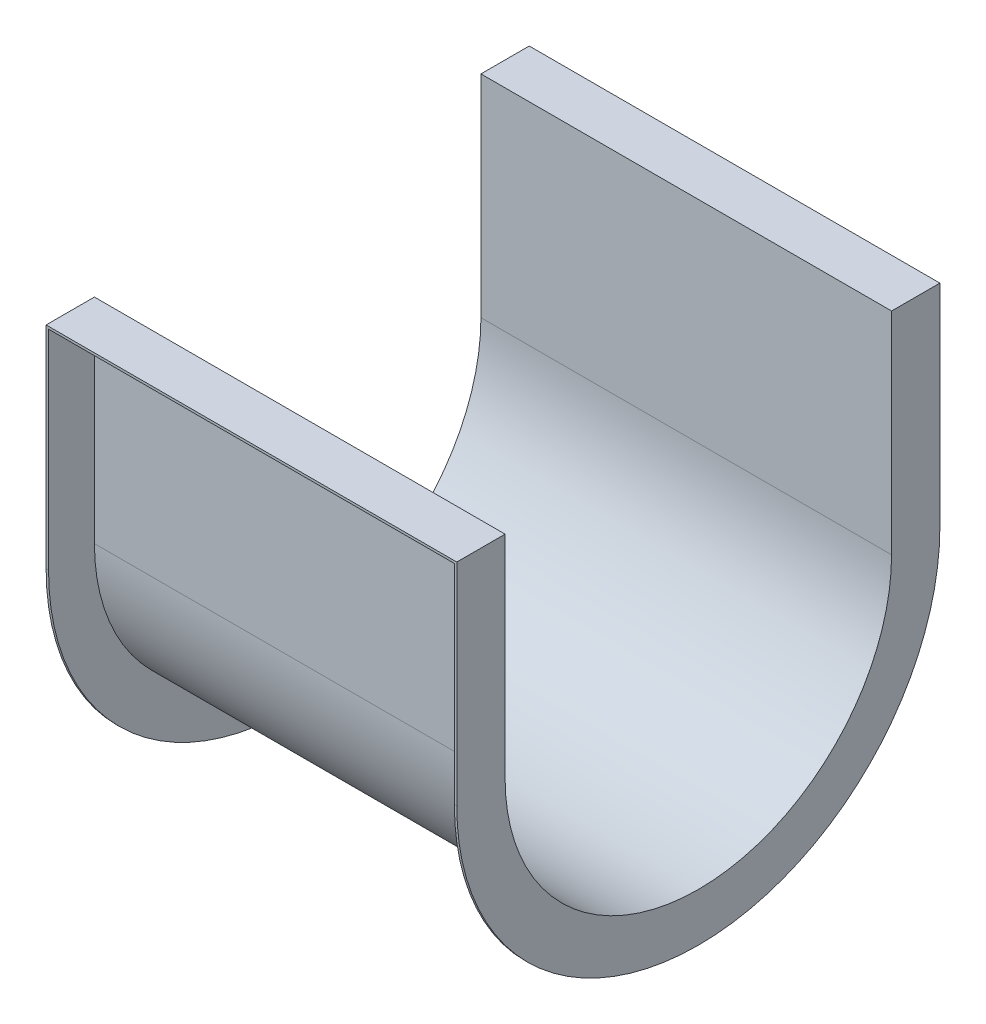
from build123d import *

# Parameters (mm, degrees)
SALIENTE_EXTRUIR1_DEPTH = 170
CROQUIS2_W              = 170
CROQUIS2_H              = 20.000000000000014
SALIENTE_EXTRUIR2_DEPTH = 3.7
VACIADO1_T              = -1


with BuildPart() as part:
    # Croquis1 → Saliente-Extruir1 (new body)
    with BuildSketch(Plane(origin=(0, 0, 0), x_dir=(0, 0, -1), z_dir=(1, 0, 0))):
        with BuildLine():
            Line((80, 0), (100, 0))
            Line((100, 0), (99.99999999999999, -83.7))
            ThreePointArc((99.99999999999999, -83.7), (70.71067811865474, -154.41067811865474), (1.125e-14, -183.7))
            ThreePointArc((1.125e-14, -183.7), (-70.71067811865473, -154.41067811865474), (-99.99999999999999, -83.70000000000002))
            Line((-99.99999999999999, -83.70000000000002), (-100, -1.225e-14))
            Line((-100, -1.225e-14), (-80, -9.8e-15))
            Line((-80, -9.8e-15), (-79.99999999999999, -83.70000000000002))
            ThreePointArc((-79.99999999999999, -83.70000000000002), (-56.568542494923804, -140.26854249492382), (-1.47e-14, -163.70000000000002))
            ThreePointArc((-1.47e-14, -163.70000000000002), (56.5685424949238, -140.26854249492382), (80, -83.70000000000002))
            Line((80, -83.70000000000002), (80, 0))
        make_face()
    extrude(amount=SALIENTE_EXTRUIR1_DEPTH)

    # Croquis2 → Saliente-Extruir2 (add)
    with BuildSketch(Plane(origin=(0, 0, 0), x_dir=(1, 0, 0), z_dir=(0, 1, 0))):
        with Locations((85, 90)):
            Rectangle(CROQUIS2_W, CROQUIS2_H)
        with Locations((85, -90)):
            Rectangle(CROQUIS2_W, CROQUIS2_H)
    extrude(amount=SALIENTE_EXTRUIR2_DEPTH)

    # Vaciado1
    vaciado1_openings = [part.faces().sort_by_distance(p)[0] for p in [
        (85, -40, -100),
        (85, -183.7, 0),
        (85, -40, 100),
    ]]
    offset(amount=VACIADO1_T, openings=vaciado1_openings, kind=Kind.INTERSECTION)


solid = part.part
